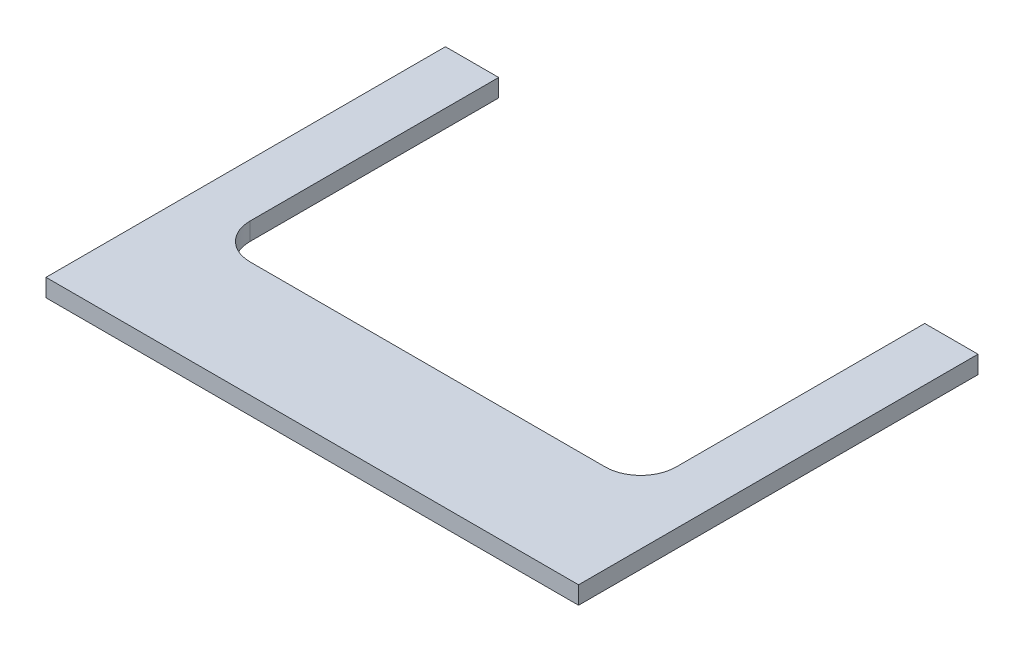
from build123d import *

# Parameters (mm, degrees)
EXTRUDE_1_DEPTH = 10
FILLET_7_R      = 20


with BuildPart() as part:
    # 草图1 → 凸台-拉伸1 (new body)
    with BuildSketch(Plane(origin=(0, 0, 0), x_dir=(1, 0, 0), z_dir=(0, 1, 0))):
        Polygon((-120, 32.5), (120, 32.5), (120, 192.5), (150, 192.5), (150, 32.5), (150, -32.5), (-150, -32.5), (-150, 32.5), (-150, 192.5), (-120, 192.5), align=None)
    extrude(amount=EXTRUDE_1_DEPTH)

    # 圆角7
    fillet_7_edges = [part.edges().sort_by_distance(p)[0] for p in [
        (120, 5, -32.5),
        (-120, 5, -32.5),
    ]]
    fillet(fillet_7_edges, radius=FILLET_7_R)


solid = part.part
